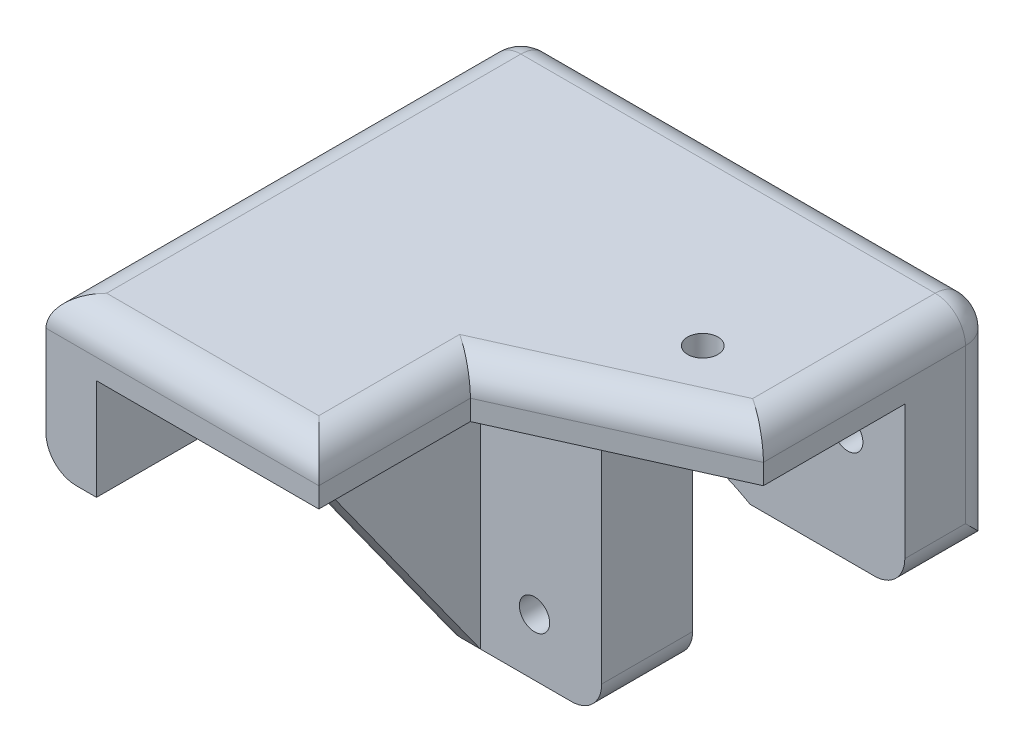
from build123d import *

# Parameters (mm, degrees)
BOSS_EXTRUDE1_DEPTH = 9
SKETCH3_R           = 1.5
CUT_EXTRUDE1_DEPTH  = 10
SKETCH4_W           = 5
SKETCH4_H           = 47
BOSS_EXTRUDE2_DEPTH = 38
CUT_EXTRUDE2_DEPTH  = 38
SKETCH6_W           = 42
SKETCH6_H           = 5
BOSS_EXTRUDE3_DEPTH = 38
SKETCH7_R           = 4
CUT_EXTRUDE3_DEPTH  = 5
CUT_EXTRUDE4_DEPTH  = 10
FILLET1_R           = 3
SKETCH9_R           = 1.5
CUT_EXTRUDE5_DEPTH  = 10
SKETCH10_R          = 3
CUT_EXTRUDE6_DEPTH  = 2


with BuildPart() as part:
    # Sketch2 → Boss-Extrude1 (new body)
    with BuildSketch(Plane.XY):
        with BuildLine():
            Line((0, 0), (0, 47))
            Line((0, 47), (47, 47))
            Line((47, 47), (47, 25.75))
            Line((47, 25.75), (31.68, 25.75))
            ThreePointArc((31.68, 25.75), (24.5283031, 28.175540714), (17, 27.58))
            Line((17, 27.58), (17, 0))
            Line((17, 0), (0, 0))
        make_face()
    extrude(amount=BOSS_EXTRUDE1_DEPTH)

    # Sketch3 → Cut-Extrude1 (cut)
    with BuildSketch(Plane.XY.offset(9)):
        with Locations((10.35, 5.65)):
            Circle(SKETCH3_R)
        with Locations((10.35, 36.65)):
            Circle(SKETCH3_R)
        with Locations((41.35, 36.65)):
            Circle(SKETCH3_R)
    extrude(amount=-CUT_EXTRUDE1_DEPTH, mode=Mode.SUBTRACT)

    # Sketch4 → Boss-Extrude2 (add)
    with BuildSketch(Plane.XY.offset(9)):
        with Locations((2.5, 23.5)):
            Rectangle(SKETCH4_W, SKETCH4_H)
    extrude(amount=BOSS_EXTRUDE2_DEPTH)

    # Sketch5 → Cut-Extrude2 (cut)
    with BuildSketch(Plane.ZY):
        Polygon((47, 32), (32, 32), (9, 0), (47, 0), align=None)
    extrude(amount=-CUT_EXTRUDE2_DEPTH, mode=Mode.SUBTRACT)

    # Sketch6 → Boss-Extrude3 (add)
    with BuildSketch(Plane.XY.offset(9)):
        with Locations((26, 44.5)):
            Rectangle(SKETCH6_W, SKETCH6_H)
    extrude(amount=BOSS_EXTRUDE3_DEPTH)

    # Sketch7 → Cut-Extrude3 (cut)
    with BuildSketch(Plane(origin=(0, 0, 0), x_dir=(-1, 0, 0), z_dir=(0, 0, -1))):
        with Locations((-10, 20)):
            Circle(SKETCH7_R)
    extrude(amount=-CUT_EXTRUDE3_DEPTH, mode=Mode.SUBTRACT)

    # Sketch8 → Cut-Extrude4 (cut)
    with BuildSketch(Plane(origin=(0, 42, 0), x_dir=(-1, 0, 0), z_dir=(0, -1, 0))):
        Polygon((-27, -32), (-47, -23), (-47, -47), (-27, -47), align=None)
    extrude(amount=-CUT_EXTRUDE4_DEPTH, mode=Mode.SUBTRACT)

    # Fillet1
    fillet1_edges = [part.edges().sort_by_distance(p)[0] for p in [
        (0, 32, 39.5),
        (0, 16, 20.5),
        (27, 47, 39.5),
        (37, 47, 27.5),
        (0, 23.5, 0),
        (47, 36.375, 0),
        (23.5, 47, 0),
        (0, 0, 4.5),
        (17, 0, 4.5),
        (17, 27.58, 4.5),
        (47, 25.75, 4.5),
        (47, 47, 11.5),
        (0, 47, 23.5),
        (13.5, 47, 47),
    ]]
    fillet(fillet1_edges, radius=FILLET1_R)

    # Sketch9 → Cut-Extrude5 (cut)
    with BuildSketch(Plane(origin=(0, 42, 0), x_dir=(-1, 0, 0), z_dir=(0, -1, 0))):
        with Locations((-37, -19)):
            Circle(SKETCH9_R)
    extrude(amount=-CUT_EXTRUDE5_DEPTH, mode=Mode.SUBTRACT)

    # Sketch10 → Cut-Extrude6 (cut)
    with BuildSketch(Plane(origin=(0, 42, 0), x_dir=(-1, 0, 0), z_dir=(0, -1, 0))):
        with Locations((-37, -19)):
            Circle(SKETCH10_R)
    extrude(amount=-CUT_EXTRUDE6_DEPTH, mode=Mode.SUBTRACT)


solid = part.part
